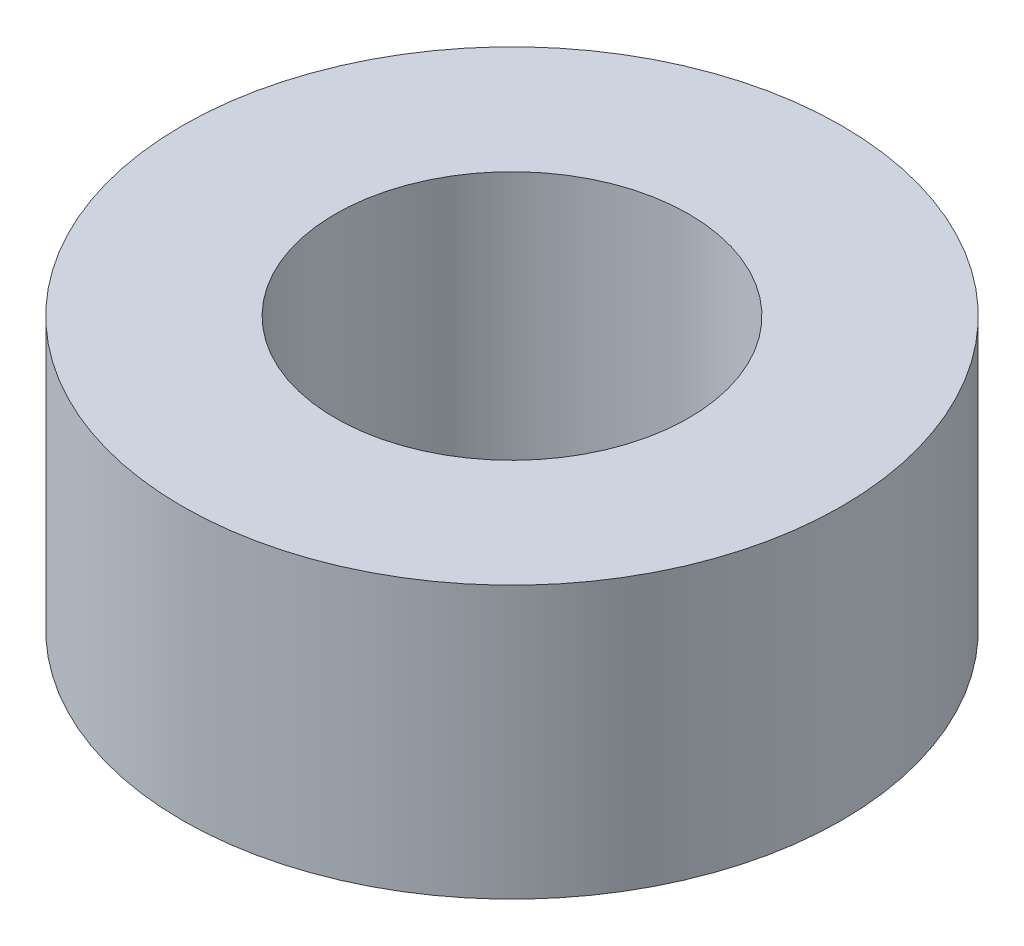
from build123d import *

# Parameters (mm, degrees)
SCHIZZO1_W = 22.5
SCHIZZO1_H = 40


with BuildPart() as part:
    # Schizzo1 → Rivoluzione1 (revolve)
    with BuildSketch(Plane.XY):
        with Locations((-37.25, 20)):
            Rectangle(SCHIZZO1_W, SCHIZZO1_H)
    revolve(axis=Axis((0, 0, 0), (0, 1, 0)))


solid = part.part
